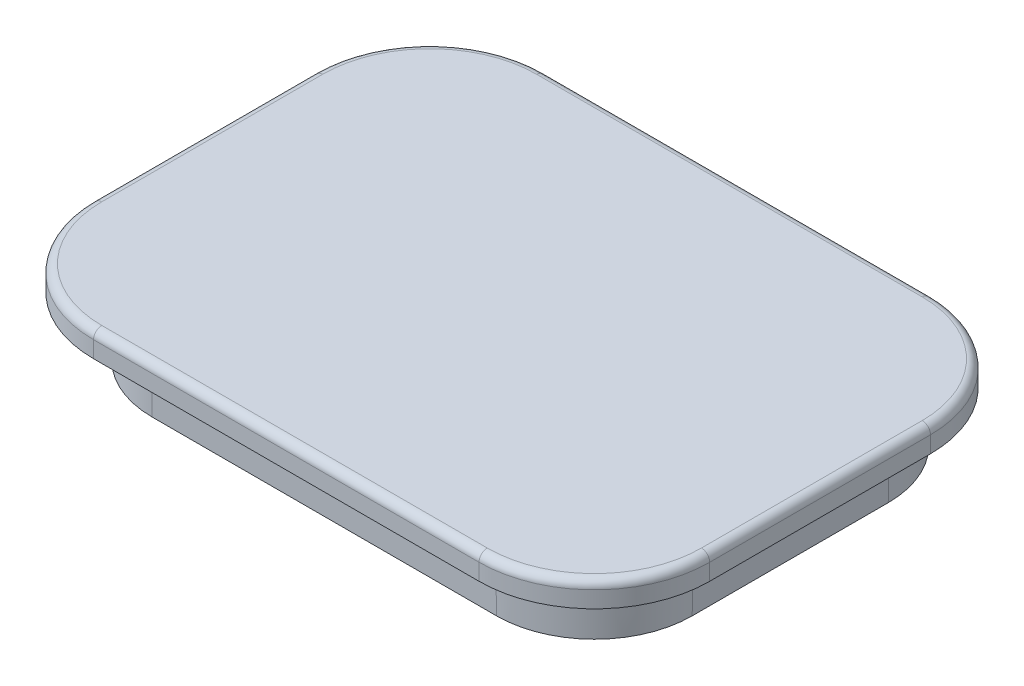
from build123d import *

# Parameters (mm, degrees)
BOSS_EXTRUDE1_DEPTH = 3.6
BOSS_EXTRUDE2_DEPTH = 1.5
CUT_EXTRUDE1_DEPTH  = 3.6
BOSS_EXTRUDE5_DEPTH = 3.6
CHAMFER1_SIZE       = 3.6
CHAMFER1_SIZE_2     = 0.062838234
FILLET3_R           = 1
FILLET4_R           = 0.5


with BuildPart() as part:
    # Sketch1 → Boss-Extrude1 (new body)
    with BuildSketch(Plane(origin=(0, 0, 0), x_dir=(1, 0, 0), z_dir=(0, 1, 0))):
        with BuildLine():
            Line((6, 0), (26.9, 0))
            ThreePointArc((26.9, 0), (31.142640687, 1.757359313), (32.9, 6))
            Line((32.9, 6), (32.9, 17.9))
            ThreePointArc((32.9, 17.9), (31.142640687, 22.142640687), (26.9, 23.9))
            Line((26.9, 23.9), (6, 23.9))
            ThreePointArc((6, 23.9), (1.757359313, 22.142640687), (0, 17.9))
            Line((0, 17.9), (0, 6))
            ThreePointArc((0, 6), (1.757359313, 1.757359313), (6, 0))
        make_face()
    extrude(amount=BOSS_EXTRUDE1_DEPTH)

    # Sketch2 → Boss-Extrude2 (add)
    with BuildSketch(Plane(origin=(0, 3.6, 0), x_dir=(1, 0, 0), z_dir=(0, 1, 0))):
        with BuildLine():
            Line((4.75, 25.15), (28.15, 25.15))
            ThreePointArc((28.15, 25.15), (33.099747468, 23.099747468), (35.15, 18.15))
            Line((35.15, 18.15), (35.15, 4.75))
            ThreePointArc((35.15, 4.75), (33.099747468, -0.199747468), (28.15, -2.25))
            Line((28.15, -2.25), (4.75, -2.25))
            ThreePointArc((4.75, -2.25), (-0.199747468, -0.199747468), (-2.25, 4.75))
            Line((-2.25, 4.75), (-2.25, 18.15))
            ThreePointArc((-2.25, 18.15), (-0.199747468, 23.099747468), (4.75, 25.15))
        make_face()
    extrude(amount=BOSS_EXTRUDE2_DEPTH)

    # Sketch3 → Cut-Extrude1 (cut)
    with BuildSketch(Plane.XZ):
        with BuildLine():
            Line((25.7, -22.7), (7.2, -22.7))
            ThreePointArc((7.2, -22.7), (2.957359313, -20.942640687), (1.2, -16.7))
            Line((1.2, -16.7), (1.2, -7.2))
            ThreePointArc((1.2, -7.2), (2.957359313, -2.957359313), (7.2, -1.2))
            Line((7.2, -1.2), (25.7, -1.2))
            ThreePointArc((25.7, -1.2), (29.942640687, -2.957359313), (31.7, -7.2))
            Line((31.7, -7.2), (31.7, -16.7))
            ThreePointArc((31.7, -16.7), (29.942640687, -20.942640687), (25.7, -22.7))
        make_face()
    extrude(amount=-CUT_EXTRUDE1_DEPTH, mode=Mode.SUBTRACT)

    # Sketch5 → Boss-Extrude5 (add)
    with BuildSketch(Plane.XZ.offset(-3.6)):
        with BuildLine():
            Line((7.2, -1.2), (8.4, -1.2))
            Line((8.4, -1.2), (8.4, -6.2))
            ThreePointArc((8.4, -6.2), (8.692893219, -6.907106781), (9.4, -7.2))
            Line((9.4, -7.2), (23.5, -7.2))
            ThreePointArc((23.5, -7.2), (24.207106781, -6.907106781), (24.5, -6.2))
            Line((24.5, -6.2), (24.5, -1.2))
            Line((24.5, -1.2), (25.7, -1.2))
            Line((25.7, -1.2), (25.7, -6.2))
            ThreePointArc((25.7, -6.2), (25.992893219, -6.907106781), (26.7, -7.2))
            Line((26.7, -7.2), (31.7, -7.2))
            Line((31.7, -7.2), (31.7, -8.4))
            Line((31.7, -8.4), (26.7, -8.4))
            ThreePointArc((26.7, -8.4), (25.992893219, -8.692893219), (25.7, -9.4))
            Line((25.7, -9.4), (25.7, -14.5))
            ThreePointArc((25.7, -14.5), (25.992893219, -15.207106781), (26.7, -15.5))
            Line((26.7, -15.5), (31.7, -15.5))
            Line((31.7, -15.5), (31.7, -16.7))
            Line((31.7, -16.7), (26.7, -16.7))
            ThreePointArc((26.7, -16.7), (25.992893219, -16.992893219), (25.7, -17.7))
            Line((25.7, -17.7), (25.7, -22.7))
            Line((25.7, -22.7), (24.5, -22.7))
            Line((24.5, -22.7), (24.5, -17.7))
            ThreePointArc((24.5, -17.7), (24.207106781, -16.992893219), (23.5, -16.7))
            Line((23.5, -16.7), (9.4, -16.7))
            ThreePointArc((9.4, -16.7), (8.692893219, -16.992893219), (8.4, -17.7))
            Line((8.4, -17.7), (8.4, -22.7))
            Line((8.4, -22.7), (7.2, -22.7))
            Line((7.2, -22.7), (7.2, -17.7))
            ThreePointArc((7.2, -17.7), (6.907106781, -16.992893219), (6.2, -16.7))
            Line((6.2, -16.7), (1.2, -16.7))
            Line((1.2, -16.7), (1.2, -15.5))
            Line((1.2, -15.5), (6.2, -15.5))
            ThreePointArc((6.2, -15.5), (6.907106781, -15.207106781), (7.2, -14.5))
            Line((7.2, -14.5), (7.2, -9.4))
            ThreePointArc((7.2, -9.4), (6.907106781, -8.692893219), (6.2, -8.4))
            Line((6.2, -8.4), (1.2, -8.4))
            Line((1.2, -8.4), (1.2, -7.2))
            Line((1.2, -7.2), (6.2, -7.2))
            ThreePointArc((6.2, -7.2), (6.907106781, -6.907106781), (7.2, -6.2))
            Line((7.2, -6.2), (7.2, -1.2))
        make_face()
        with BuildLine():
            Line((9.4, -8.4), (23.5, -8.4))
            ThreePointArc((23.5, -8.4), (24.207106781, -8.692893219), (24.5, -9.4))
            Line((24.5, -9.4), (24.5, -14.5))
            ThreePointArc((24.5, -14.5), (24.207106781, -15.207106781), (23.5, -15.5))
            Line((23.5, -15.5), (9.4, -15.5))
            ThreePointArc((9.4, -15.5), (8.692893219, -15.207106781), (8.4, -14.5))
            Line((8.4, -14.5), (8.4, -9.4))
            ThreePointArc((8.4, -9.4), (8.692893219, -8.692893219), (9.4, -8.4))
        make_face(mode=Mode.SUBTRACT)
    extrude(amount=BOSS_EXTRUDE5_DEPTH)

    # Chamfer1
    # the kernel refuses this chamfer: 3.6, 0.062838234 mm, written as the material it takes off along each edge
    with BuildSketch(Plane(origin=(0, 0, -17.9), x_dir=(-0.0006712501823120534, 0.9999997747115711, 0), z_dir=(0, 0, 1))) as chamfer1_piece_1_section:
        Polygon((CHAMFER1_SIZE * 0.999999774712, -CHAMFER1_SIZE * 0.000671250182312), (-CHAMFER1_SIZE_2 * 0.000671250179552, -CHAMFER1_SIZE_2 * 0.999999770599), (0, 0), align=None)
    chamfer1_piece_1 = extrude(amount=11.9, mode=Mode.PRIVATE)
    chamfer1_piece_1 = split(chamfer1_piece_1, bisect_by=Plane(origin=(-0.01902042, 3.6, -11.95), z_dir=(0, -1, 0)), keep=Keep.TOP, mode=Mode.PRIVATE)
    add(chamfer1_piece_1, mode=Mode.SUBTRACT)
    with BuildSketch(Plane(origin=(6, 0, -6), x_dir=(-1, 0, 0), z_dir=(0, 0, -1))) as chamfer1_piece_2_section:
        Polygon((6, CHAMFER1_SIZE), (6 - CHAMFER1_SIZE_2 * 0.999999995888, 0), (6, 0), align=None)
    chamfer1_piece_2 = revolve(axis=Axis((6, 0, -6), (0, 1, 0)), revolution_arc=90, mode=Mode.PRIVATE)
    chamfer1_piece_2 = split(chamfer1_piece_2, bisect_by=Plane(origin=(1.769655981, 3.6, -1.769655981), z_dir=(0, -1, 0)), keep=Keep.TOP, mode=Mode.PRIVATE)
    add(chamfer1_piece_2, mode=Mode.SUBTRACT)
    with BuildSketch(Plane(origin=(6, 0, -17.9), x_dir=(0, 0, -1), z_dir=(1, 0, 0))) as chamfer1_piece_3_section:
        Polygon((6, CHAMFER1_SIZE), (6 - CHAMFER1_SIZE_2 * 0.999999995888, 0), (6, 0), align=None)
    chamfer1_piece_3 = revolve(axis=Axis((6, 0, -17.9), (0, 1, 0)), revolution_arc=90, mode=Mode.PRIVATE)
    chamfer1_piece_3 = split(chamfer1_piece_3, bisect_by=Plane(origin=(1.769655981, 3.6, -22.130344019), z_dir=(0, -1, 0)), keep=Keep.TOP, mode=Mode.PRIVATE)
    add(chamfer1_piece_3, mode=Mode.SUBTRACT)
    with BuildSketch(Plane(origin=(6, 0, 0), x_dir=(0, 0.9999997747115711, 0.0006712501823120534), z_dir=(1, 0, 0))) as chamfer1_piece_4_section:
        Polygon((CHAMFER1_SIZE * 0.999999774712, -CHAMFER1_SIZE * 0.000671250182312), (-CHAMFER1_SIZE_2 * 0.000671250179552, -CHAMFER1_SIZE_2 * 0.999999770599), (0, 0), align=None)
    chamfer1_piece_4 = extrude(amount=20.9, mode=Mode.PRIVATE)
    chamfer1_piece_4 = split(chamfer1_piece_4, bisect_by=Plane(origin=(16.45, 3.6, 0.01902042), z_dir=(0, -1, 0)), keep=Keep.TOP, mode=Mode.PRIVATE)
    add(chamfer1_piece_4, mode=Mode.SUBTRACT)
    with BuildSketch(Plane(origin=(26.9, 0, -23.9), x_dir=(0, 0.9999997747115711, -0.0006712501823119971), z_dir=(-1, 0, 0))) as chamfer1_piece_5_section:
        Polygon((CHAMFER1_SIZE * 0.999999774712, -CHAMFER1_SIZE * 0.000671250182312), (-CHAMFER1_SIZE_2 * 0.000671250179552, -CHAMFER1_SIZE_2 * 0.999999770599), (0, 0), align=None)
    chamfer1_piece_5 = extrude(amount=20.9, mode=Mode.PRIVATE)
    chamfer1_piece_5 = split(chamfer1_piece_5, bisect_by=Plane(origin=(16.45, 3.6, -23.91902042), z_dir=(0, -1, 0)), keep=Keep.TOP, mode=Mode.PRIVATE)
    add(chamfer1_piece_5, mode=Mode.SUBTRACT)
    with BuildSketch(Plane(origin=(26.9, 0, -6), x_dir=(0, 0, 1), z_dir=(-1, 0, 0))) as chamfer1_piece_6_section:
        Polygon((6, CHAMFER1_SIZE), (6 - CHAMFER1_SIZE_2 * 0.999999995888, 0), (6, 0), align=None)
    chamfer1_piece_6 = revolve(axis=Axis((26.9, 0, -6), (0, 1, 0)), revolution_arc=90, mode=Mode.PRIVATE)
    chamfer1_piece_6 = split(chamfer1_piece_6, bisect_by=Plane(origin=(31.130344019, 3.6, -1.769655981), z_dir=(0, -1, 0)), keep=Keep.TOP, mode=Mode.PRIVATE)
    add(chamfer1_piece_6, mode=Mode.SUBTRACT)
    with BuildSketch(Plane(origin=(26.9, 0, -17.9), x_dir=(1, 0, 0), z_dir=(0, 0, 1))) as chamfer1_piece_7_section:
        Polygon((6, CHAMFER1_SIZE), (6 - CHAMFER1_SIZE_2 * 0.999999995888, 0), (6, 0), align=None)
    chamfer1_piece_7 = revolve(axis=Axis((26.9, 0, -17.9), (0, 1, 0)), revolution_arc=90, mode=Mode.PRIVATE)
    chamfer1_piece_7 = split(chamfer1_piece_7, bisect_by=Plane(origin=(31.130344019, 3.6, -22.130344019), z_dir=(0, -1, 0)), keep=Keep.TOP, mode=Mode.PRIVATE)
    add(chamfer1_piece_7, mode=Mode.SUBTRACT)
    with BuildSketch(Plane(origin=(32.9, 0, -6), x_dir=(0.000671250182312946, 0.9999997747115711, 0), z_dir=(0, 0, -1))) as chamfer1_piece_8_section:
        Polygon((CHAMFER1_SIZE * 0.999999774712, -CHAMFER1_SIZE * 0.000671250182313), (-CHAMFER1_SIZE_2 * 0.000671250179553, -CHAMFER1_SIZE_2 * 0.999999770599), (0, 0), align=None)
    chamfer1_piece_8 = extrude(amount=11.9, mode=Mode.PRIVATE)
    chamfer1_piece_8 = split(chamfer1_piece_8, bisect_by=Plane(origin=(32.91902042, 3.6, -11.95), z_dir=(0, -1, 0)), keep=Keep.TOP, mode=Mode.PRIVATE)
    add(chamfer1_piece_8, mode=Mode.SUBTRACT)

    # Fillet3
    fillet3_edges = [part.edges().sort_by_distance(p)[0] for p in [
        (1.2, 1.8, -8.4),
        (1.2, 1.8, -15.5),
        (8.4, 1.8, -22.7),
        (24.5, 1.8, -22.7),
        (31.7, 1.8, -15.5),
        (31.7, 1.8, -8.4),
        (24.5, 1.8, -1.2),
        (8.4, 1.8, -1.2),
        (7.2, 1.8, -22.7),
        (1.2, 1.8, -16.7),
        (1.2, 1.8, -7.2),
        (7.2, 1.8, -1.2),
        (25.7, 1.8, -1.2),
        (31.7, 1.8, -7.2),
        (31.7, 1.8, -16.7),
        (25.7, 1.8, -22.7),
    ]]
    fillet(fillet3_edges, radius=FILLET3_R)

    # Fillet4
    fillet4_edges = [part.edges().sort_by_distance(p)[0] for p in [
        (-0.199747468, 5.1, 0.199747468),
        (16.45, 5.1, 2.25),
        (33.099747468, 5.1, 0.199747468),
        (35.15, 5.1, -11.45),
        (33.099747468, 5.1, -23.099747468),
        (16.45, 5.1, -25.15),
        (-0.199747468, 5.1, -23.099747468),
        (-2.25, 5.1, -11.45),
    ]]
    fillet(fillet4_edges, radius=FILLET4_R)


solid = part.part
